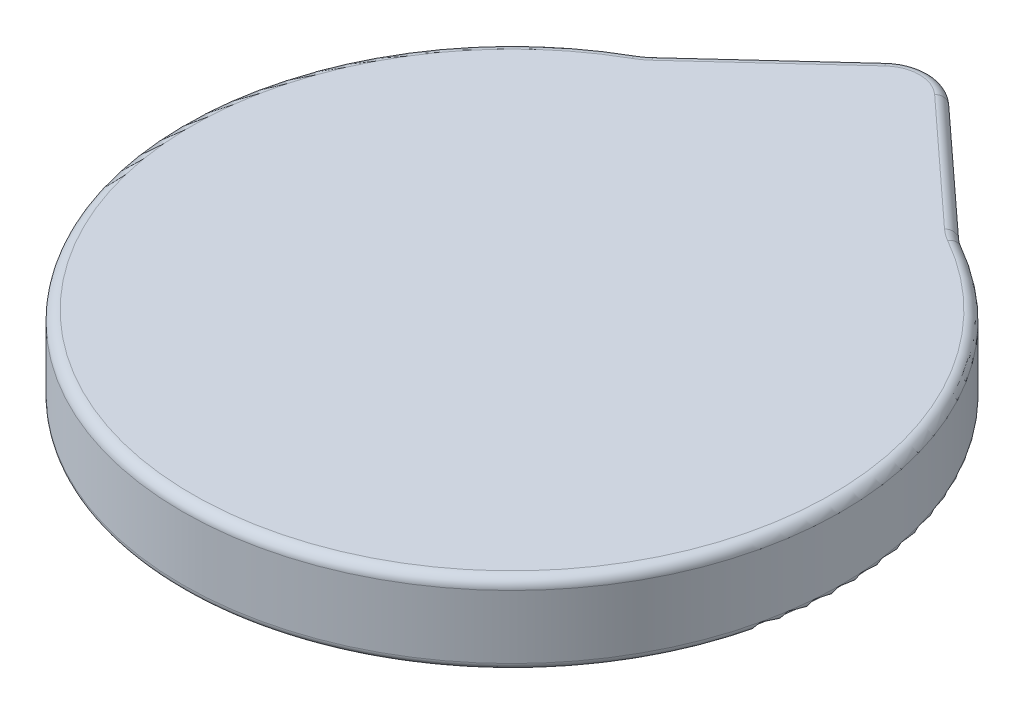
from build123d import *

# Parameters (mm, degrees)
BOSS_EXTRUDE1_DEPTH = 20
BOSS_EXTRUDE2_START = 4
BOSS_EXTRUDE2_DEPTH = 4
FILLET1_R           = 4
FILLET2_R           = 3
FILLET3_R           = 2


with BuildPart() as part:
    # Sketch2 → Boss-Extrude1 (new body)
    with BuildSketch(Plane(origin=(0, 0, 0), x_dir=(1, 0, 0), z_dir=(0, 1, 0))):
        with BuildLine():
            Line((9.470598027, 121.732262156), (45.948280407, 88.226297118))
            ThreePointArc((45.948280407, 88.226297118), (47.350268632, 87.077889107), (48.873132869, 86.09539409))
            ThreePointArc((48.873132869, 86.09539409), (0, -99), (-48.873132869, 86.09539409))
            ThreePointArc((-48.873132869, 86.09539409), (-47.350268632, 87.077889107), (-45.948280407, 88.226297118))
            Line((-45.948280407, 88.226297118), (-9.470598027, 121.732262156))
            ThreePointArc((-9.470598027, 121.732262156), (0, 125.42169607), (9.470598027, 121.732262156))
        make_face()
        with BuildLine():
            Line((-6.764712877, 118.786386131), (-43.242395256, 85.280421094))
            ThreePointArc((-43.242395256, 85.280421094), (-44.994880537, 83.84491108), (-46.898460834, 82.616792309))
            ThreePointArc((-46.898460834, 82.616792309), (0, -95), (46.898460834, 82.616792309))
            ThreePointArc((46.898460834, 82.616792309), (44.994880537, 83.84491108), (43.242395256, 85.280421094))
            Line((43.242395256, 85.280421094), (6.764712877, 118.786386131))
            ThreePointArc((6.764712877, 118.786386131), (0, 121.42169607), (-6.764712877, 118.786386131))
        make_face(mode=Mode.SUBTRACT)
    extrude(amount=-BOSS_EXTRUDE1_DEPTH)

    # Sketch2<2> → Boss-Extrude2 (add)
    with BuildSketch(Plane(origin=(0, 0, 0), x_dir=(1, 0, 0), z_dir=(0, 1, 0)).offset(BOSS_EXTRUDE2_START)):
        with BuildLine():
            Line((9.470598027, 121.732262156), (45.948280407, 88.226297118))
            ThreePointArc((45.948280407, 88.226297118), (47.350268632, 87.077889107), (48.873132869, 86.09539409))
            ThreePointArc((48.873132869, 86.09539409), (0, -99), (-48.873132869, 86.09539409))
            ThreePointArc((-48.873132869, 86.09539409), (-47.350268632, 87.077889107), (-45.948280407, 88.226297118))
            Line((-45.948280407, 88.226297118), (-9.470598027, 121.732262156))
            ThreePointArc((-9.470598027, 121.732262156), (0, 125.42169607), (9.470598027, 121.732262156))
        make_face()
    extrude(amount=-BOSS_EXTRUDE2_DEPTH)

    # Fillet1
    fillet1_edges = [part.edges().sort_by_distance(p)[0] for p in [
        (44.994880537, 0, -83.84491108),
        (25.003554066, 0, -102.033403612),
        (0, 0, -121.42169607),
        (-25.003554066, 0, -102.033403612),
        (-44.994880537, 0, -83.84491108),
        (0, 0, 95),
    ]]
    fillet(fillet1_edges, radius=FILLET1_R)

    # Fillet2
    fillet2_edges = [part.edges().sort_by_distance(p)[0] for p in [
        (-47.350268632, 4, -87.077889107),
        (27.709439217, 4, -104.979279637),
        (0, 4, -125.42169607),
        (0, 4, 99),
        (47.350268632, 4, -87.077889107),
        (-27.709439217, 4, -104.979279637),
    ]]
    fillet(fillet2_edges, radius=FILLET2_R)

    # Fillet3
    fillet3_edges = [part.edges().sort_by_distance(p)[0] for p in [
        (47.350268632, -20, -87.077889107),
        (27.709439217, -20, -104.979279637),
        (0, -20, -125.42169607),
        (44.994880537, -20, -83.84491108),
        (0, -20, 95),
        (-44.994880537, -20, -83.84491108),
        (-25.003554066, -20, -102.033403612),
        (0, -20, -121.42169607),
        (25.003554066, -20, -102.033403612),
        (-27.709439217, -20, -104.979279637),
        (-47.350268632, -20, -87.077889107),
        (0, -20, 99),
    ]]
    fillet(fillet3_edges, radius=FILLET3_R - 0.0001)  # a hair under: the kernel refuses the full size


solid = part.part
